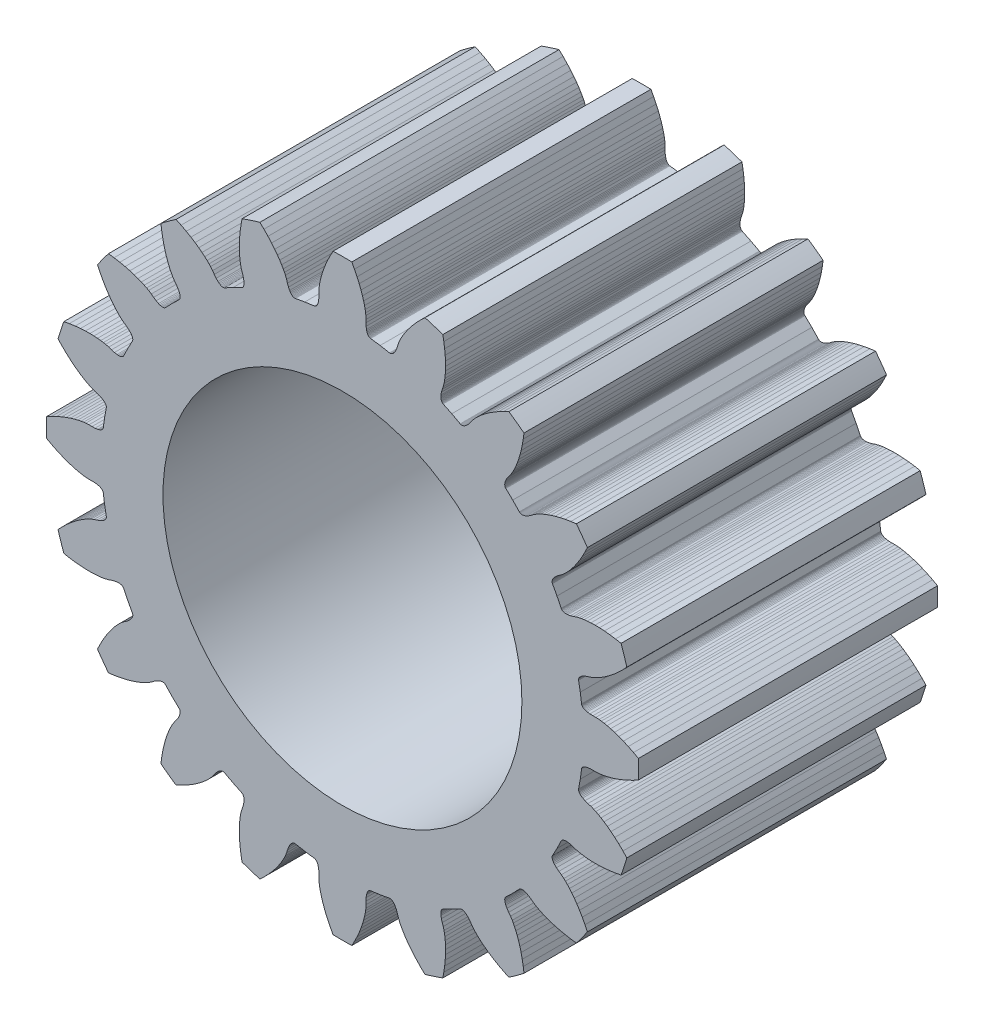
from build123d import *

# Parameters (mm, degrees)
MODEL_R             = 6
BOSS_EXTRUDE1_DEPTH = 10


with BuildPart() as part:
    # Model → Boss-Extrude1 (new body)
    with BuildSketch(Plane.XY):
        with BuildLine():
            Line((9.2379519, 2.4882789), (9.3780058, 2.624313))
            Line((9.3780058, 2.624313), (9.507329774, 2.760508399))
            ThreePointArc((9.507329774, 2.760508399), (9.415446022, 3.059263845), (9.314177481, 3.354969988))
            Line((9.314177481, 3.354969988), (9.1294985, 3.3891397))
            Line((9.1294985, 3.3891397), (8.9362338, 3.416872))
            Line((8.9362338, 3.416872), (8.7574297, 3.4349242))
            Line((8.7574297, 3.4349242), (8.5927812, 3.4446224))
            Line((8.5927812, 3.4446224), (8.4425429, 3.4471849))
            Line((8.4425429, 3.4471849), (8.3064777, 3.4437817))
            Line((8.3064777, 3.4437817), (8.1864137, 3.435737))
            Line((8.1864137, 3.435737), (8.0804821, 3.4241636))
            Line((8.0804821, 3.4241636), (7.9915462, 3.4106665))
            Line((7.9915462, 3.4106665), (7.917684, 3.3963088))
            Line((7.917684, 3.3963088), (7.8137095, 3.3696385))
            Line((7.8137095, 3.3696385), (7.71995, 3.3364447))
            Line((7.71995, 3.3364447), (7.6218333, 3.3081238))
            Line((7.6218333, 3.3081238), (7.5352909, 3.2933434))
            Line((7.5352909, 3.2933434), (7.4966615, 3.2907201))
            Line((7.4966615, 3.2907201), (7.4612697, 3.291082))
            Line((7.4612697, 3.291082), (7.4292239, 3.2943048))
            Line((7.4292239, 3.2943048), (7.4006412, 3.3002461))
            Line((7.4006412, 3.3002461), (7.375599, 3.3087546))
            Line((7.375599, 3.3087546), (7.3541968, 3.3196788))
            Line((7.3541968, 3.3196788), (7.3365339, 3.33289))
            Line((7.3365339, 3.33289), (7.3226832, 3.3482231))
            Line((7.3226832, 3.3482231), (7.3127264, 3.3655178))
            Line((7.3127264, 3.3655178), (7.1726025, 3.6546235))
            Line((7.1726025, 3.6546235), (7.0210738, 3.9379182))
            Line((7.0210738, 3.9379182), (7.0129346, 3.956139))
            Line((7.0129346, 3.956139), (7.0086711, 3.9763571))
            Line((7.0086711, 3.9763571), (7.008365, 3.998412))
            Line((7.008365, 3.998412), (7.012107, 4.0221478))
            Line((7.012107, 4.0221478), (7.019943, 4.0474085))
            Line((7.019943, 4.0474085), (7.0319368, 4.0740246))
            Line((7.0319368, 4.0740246), (7.0481656, 4.1018445))
            Line((7.0481656, 4.1018445), (7.0686756, 4.1306898))
            Line((7.0686756, 4.1306898), (7.0935037, 4.1603997))
            Line((7.0935037, 4.1603997), (7.1563296, 4.2217263))
            Line((7.1563296, 4.2217263), (7.2369132, 4.2844578))
            Line((7.2369132, 4.2844578), (7.318878, 4.3408))
            Line((7.318878, 4.3408), (7.4015694, 4.4092407))
            Line((7.4015694, 4.4092407), (7.4566001, 4.4605573))
            Line((7.4566001, 4.4605573), (7.5197947, 4.5245745))
            Line((7.5197947, 4.5245745), (7.5914229, 4.6034723))
            Line((7.5914229, 4.6034723), (7.668503, 4.6958775))
            Line((7.668503, 4.6958775), (7.7512334, 4.8039562))
            Line((7.7512334, 4.8039562), (7.8374682, 4.9270078))
            Line((7.8374682, 4.9270078), (7.9264001, 5.0659117))
            Line((7.9264001, 5.0659117), (8.0168939, 5.221178))
            Line((8.0168939, 5.221178), (8.1080562, 5.3938331))
            Line((8.1080562, 5.3938331), (8.188964013, 5.563326015))
            ThreePointArc((8.188964013, 5.563326015), (8.009256945, 5.819065738), (7.821566517, 6.069005209))
            Line((7.821566517, 6.069005209), (7.6353673, 6.0444336))
            Line((7.6353673, 6.0444336), (7.4429918, 6.0110865))
            Line((7.4429918, 6.0110865), (7.2673607, 5.9730017))
            Line((7.2673607, 5.9730017), (7.1077737, 5.931346))
            Line((7.1077737, 5.931346), (6.9640967, 5.8873569))
            Line((6.9640967, 5.8873569), (6.8357427, 5.8420738))
            Line((6.8357427, 5.8420738), (6.724041, 5.797321))
            Line((6.724041, 5.797321), (6.6268704, 5.7535794))
            Line((6.6268704, 5.7535794), (6.5464582, 5.7132602))
            Line((6.5464582, 5.7132602), (6.4806478, 5.6767805))
            Line((6.4806478, 5.6767805), (6.3900038, 5.6192857))
            Line((6.3900038, 5.6192857), (6.3110907, 5.5587432))
            Line((6.3110907, 5.5587432), (6.2265278, 5.5014887))
            Line((6.2265278, 5.5014887), (6.1487884, 5.4606887))
            Line((6.1487884, 5.4606887), (6.1128603, 5.4462566))
            Line((6.1128603, 5.4462566), (6.0790889, 5.4356642))
            Line((6.0790889, 5.4356642), (6.0476156, 5.4288265))
            Line((6.0476156, 5.4288265), (6.0185959, 5.4256445))
            Line((6.0185959, 5.4256445), (5.9921501, 5.425998))
            Line((5.9921501, 5.425998), (5.9684196, 5.429774))
            Line((5.9684196, 5.429774), (5.9475388, 5.4368804))
            Line((5.9475388, 5.4368804), (5.9296278, 5.4471829))
            Line((5.9296278, 5.4471829), (5.9148139, 5.4605543))
            Line((5.9148139, 5.4605543), (5.6922096, 5.6922096))
            Line((5.6922096, 5.6922096), (5.4605543, 5.9148139))
            Line((5.4605543, 5.9148139), (5.4471829, 5.9296278))
            Line((5.4471829, 5.9296278), (5.4368804, 5.9475388))
            Line((5.4368804, 5.9475388), (5.429774, 5.9684196))
            Line((5.429774, 5.9684196), (5.425998, 5.9921501))
            Line((5.425998, 5.9921501), (5.4256445, 6.0185959))
            Line((5.4256445, 6.0185959), (5.4288265, 6.0476156))
            Line((5.4288265, 6.0476156), (5.4356642, 6.0790889))
            Line((5.4356642, 6.0790889), (5.4462566, 6.1128603))
            Line((5.4462566, 6.1128603), (5.4606887, 6.1487884))
            Line((5.4606887, 6.1487884), (5.5014887, 6.2265278))
            Line((5.5014887, 6.2265278), (5.5587432, 6.3110907))
            Line((5.5587432, 6.3110907), (5.6192857, 6.3900038))
            Line((5.6192857, 6.3900038), (5.6767805, 6.4806478))
            Line((5.6767805, 6.4806478), (5.7132602, 6.5464582))
            Line((5.7132602, 6.5464582), (5.7535794, 6.6268704))
            Line((5.7535794, 6.6268704), (5.797321, 6.724041))
            Line((5.797321, 6.724041), (5.8420738, 6.8357427))
            Line((5.8420738, 6.8357427), (5.8873569, 6.9640967))
            Line((5.8873569, 6.9640967), (5.931346, 7.1077737))
            Line((5.931346, 7.1077737), (5.9730017, 7.2673607))
            Line((5.9730017, 7.2673607), (6.0110865, 7.4429918))
            Line((6.0110865, 7.4429918), (6.0444336, 7.6353673))
            Line((6.0444336, 7.6353673), (6.069005209, 7.821566417))
            ThreePointArc((6.069005209, 7.821566417), (5.819065783, 8.009256907), (5.563326015, 8.188963913))
            Line((5.563326015, 8.188963913), (5.3938331, 8.1080562))
            Line((5.3938331, 8.1080562), (5.221178, 8.0168939))
            Line((5.221178, 8.0168939), (5.0659117, 7.9264001))
            Line((5.0659117, 7.9264001), (4.9270078, 7.8374682))
            Line((4.9270078, 7.8374682), (4.8039562, 7.7512334))
            Line((4.8039562, 7.7512334), (4.6958775, 7.668503))
            Line((4.6958775, 7.668503), (4.6034723, 7.5914229))
            Line((4.6034723, 7.5914229), (4.5245745, 7.5197947))
            Line((4.5245745, 7.5197947), (4.4605573, 7.4566001))
            Line((4.4605573, 7.4566001), (4.4092407, 7.4015694))
            Line((4.4092407, 7.4015694), (4.3408, 7.318878))
            Line((4.3408, 7.318878), (4.2844578, 7.2369132))
            Line((4.2844578, 7.2369132), (4.2217263, 7.1563296))
            Line((4.2217263, 7.1563296), (4.1603997, 7.0935037))
            Line((4.1603997, 7.0935037), (4.1306898, 7.0686756))
            Line((4.1306898, 7.0686756), (4.1018445, 7.0481656))
            Line((4.1018445, 7.0481656), (4.0740246, 7.0319368))
            Line((4.0740246, 7.0319368), (4.0474085, 7.019943))
            Line((4.0474085, 7.019943), (4.0221478, 7.012107))
            Line((4.0221478, 7.012107), (3.998412, 7.008365))
            Line((3.998412, 7.008365), (3.9763571, 7.0086711))
            Line((3.9763571, 7.0086711), (3.956139, 7.0129346))
            Line((3.956139, 7.0129346), (3.9379182, 7.0210738))
            Line((3.9379182, 7.0210738), (3.6546235, 7.1726025))
            Line((3.6546235, 7.1726025), (3.3655178, 7.3127264))
            Line((3.3655178, 7.3127264), (3.3482231, 7.3226832))
            Line((3.3482231, 7.3226832), (3.33289, 7.3365339))
            Line((3.33289, 7.3365339), (3.3196788, 7.3541968))
            Line((3.3196788, 7.3541968), (3.3087546, 7.375599))
            Line((3.3087546, 7.375599), (3.3002461, 7.4006412))
            Line((3.3002461, 7.4006412), (3.2943048, 7.4292239))
            Line((3.2943048, 7.4292239), (3.291082, 7.4612697))
            Line((3.291082, 7.4612697), (3.2907201, 7.4966615))
            Line((3.2907201, 7.4966615), (3.2933434, 7.5352909))
            Line((3.2933434, 7.5352909), (3.3081238, 7.6218333))
            Line((3.3081238, 7.6218333), (3.3364447, 7.71995))
            Line((3.3364447, 7.71995), (3.3696385, 7.8137095))
            Line((3.3696385, 7.8137095), (3.3963088, 7.917684))
            Line((3.3963088, 7.917684), (3.4106665, 7.9915462))
            Line((3.4106665, 7.9915462), (3.4241636, 8.0804821))
            Line((3.4241636, 8.0804821), (3.435737, 8.1864137))
            Line((3.435737, 8.1864137), (3.4437817, 8.3064777))
            Line((3.4437817, 8.3064777), (3.4471849, 8.4425429))
            Line((3.4471849, 8.4425429), (3.4446224, 8.5927812))
            Line((3.4446224, 8.5927812), (3.4349242, 8.7574297))
            Line((3.4349242, 8.7574297), (3.416872, 8.9362338))
            Line((3.416872, 8.9362338), (3.3891397, 9.1294985))
            Line((3.3891397, 9.1294985), (3.354969988, 9.314177481))
            ThreePointArc((3.354969988, 9.314177481), (3.05926395, 9.415446345), (2.760508399, 9.507329774))
            Line((2.760508399, 9.507329774), (2.624313, 9.3780058))
            Line((2.624313, 9.3780058), (2.4882789, 9.2379519))
            Line((2.4882789, 9.2379519), (2.368576, 9.1039073))
            Line((2.368576, 9.1039073), (2.263952, 8.9764043))
            Line((2.263952, 8.9764043), (2.173571, 8.8563651))
            Line((2.173571, 8.8563651), (2.0963472, 8.7442857))
            Line((2.0963472, 8.7442857), (2.0322837, 8.6424234))
            Line((2.0322837, 8.6424234), (1.9793817, 8.5499202))
            Line((1.9793817, 8.5499202), (1.9380259, 8.4700362))
            Line((1.9380259, 8.4700362), (1.9062263, 8.4018411))
            Line((1.9062263, 8.4018411), (1.8666884, 8.3020476))
            Line((1.8666884, 8.3020476), (1.8384323, 8.2066837))
            Line((1.8384323, 8.2066837), (1.8036728, 8.1106591))
            Line((1.8036728, 8.1106591), (1.7647621, 8.0319571))
            Line((1.7647621, 8.0319571), (1.7441786, 7.9991633))
            Line((1.7441786, 7.9991633), (1.723083, 7.9707435))
            Line((1.723083, 7.9707435), (1.7016397, 7.9467121))
            Line((1.7016397, 7.9467121), (1.6800326, 7.9270805))
            Line((1.6800326, 7.9270805), (1.6584297, 7.9118221))
            Line((1.6584297, 7.9118221), (1.6370119, 7.9009285))
            Line((1.6370119, 7.9009285), (1.6159418, 7.8944042))
            Line((1.6159418, 7.8944042), (1.5953958, 7.8922113))
            Line((1.5953958, 7.8922113), (1.5755516, 7.8943216))
            Line((1.5755516, 7.8943216), (1.2592974, 7.9508911))
            Line((1.2592974, 7.9508911), (0.9410409, 7.9948183))
            Line((0.9410409, 7.9948183), (0.9215158, 7.9989434))
            Line((0.9215158, 7.9989434), (0.9026531, 8.0073781))
            Line((0.9026531, 8.0073781), (0.8846304, 8.020094))
            Line((0.8846304, 8.020094), (0.8676271, 8.0370729))
            Line((0.8676271, 8.0370729), (0.8517967, 8.0582602))
            Line((0.8517967, 8.0582602), (0.8373136, 8.0836079))
            Line((0.8373136, 8.0836079), (0.8243459, 8.1130895))
            Line((0.8243459, 8.1130895), (0.813065, 8.1466372))
            Line((0.813065, 8.1466372), (0.8036228, 8.1841866))
            Line((0.8036228, 8.1841866), (0.7909367, 8.2710607))
            Line((0.7909367, 8.2710607), (0.7875517, 8.3731269))
            Line((0.7875517, 8.3731269), (0.7901476, 8.4725549))
            Line((0.7901476, 8.4725549), (0.7833827, 8.5796821))
            Line((0.7833827, 8.5796821), (0.774213, 8.654366))
            Line((0.774213, 8.654366), (0.7595668, 8.7431199))
            Line((0.7595668, 8.7431199), (0.7378391, 8.8474432))
            Line((0.7378391, 8.8474432), (0.7083883, 8.9641168))
            Line((0.7083883, 8.9641168), (0.6695785, 9.0945742))
            Line((0.6695785, 9.0945742), (0.6207152, 9.2366675))
            Line((0.6207152, 9.2366675), (0.5606125, 9.3902606))
            Line((0.5606125, 9.3902606), (0.4881903, 9.5547349))
            Line((0.4881903, 9.5547349), (0.4020932, 9.7299708))
            Line((0.4020932, 9.7299708), (0.312526994, 9.895051988))
            ThreePointArc((0.312526994, 9.895051988), (4.8e-08, 9.89998593), (-0.312526897, 9.895051984))
            Line((-0.312526897, 9.895051984), (-0.4020932, 9.7299708))
            Line((-0.4020932, 9.7299708), (-0.4881903, 9.5547349))
            Line((-0.4881903, 9.5547349), (-0.5606125, 9.3902606))
            Line((-0.5606125, 9.3902606), (-0.6207152, 9.2366675))
            Line((-0.6207152, 9.2366675), (-0.6695785, 9.0945742))
            Line((-0.6695785, 9.0945742), (-0.7083883, 8.9641168))
            Line((-0.7083883, 8.9641168), (-0.7378391, 8.8474432))
            Line((-0.7378391, 8.8474432), (-0.7595668, 8.7431199))
            Line((-0.7595668, 8.7431199), (-0.774213, 8.654366))
            Line((-0.774213, 8.654366), (-0.7833827, 8.5796821))
            Line((-0.7833827, 8.5796821), (-0.7901476, 8.4725549))
            Line((-0.7901476, 8.4725549), (-0.7875517, 8.3731269))
            Line((-0.7875517, 8.3731269), (-0.7909367, 8.2710607))
            Line((-0.7909367, 8.2710607), (-0.8036228, 8.1841866))
            Line((-0.8036228, 8.1841866), (-0.813065, 8.1466372))
            Line((-0.813065, 8.1466372), (-0.8243459, 8.1130895))
            Line((-0.8243459, 8.1130895), (-0.8373136, 8.0836079))
            Line((-0.8373136, 8.0836079), (-0.8517967, 8.0582602))
            Line((-0.8517967, 8.0582602), (-0.8676271, 8.0370729))
            Line((-0.8676271, 8.0370729), (-0.8846304, 8.020094))
            Line((-0.8846304, 8.020094), (-0.9026531, 8.0073781))
            Line((-0.9026531, 8.0073781), (-0.9215158, 7.9989434))
            Line((-0.9215158, 7.9989434), (-0.9410409, 7.9948183))
            Line((-0.9410409, 7.9948183), (-1.2592974, 7.9508911))
            Line((-1.2592974, 7.9508911), (-1.5755516, 7.8943216))
            Line((-1.5755516, 7.8943216), (-1.5953958, 7.8922113))
            Line((-1.5953958, 7.8922113), (-1.6159418, 7.8944042))
            Line((-1.6159418, 7.8944042), (-1.6370119, 7.9009285))
            Line((-1.6370119, 7.9009285), (-1.6584297, 7.9118221))
            Line((-1.6584297, 7.9118221), (-1.6800326, 7.9270805))
            Line((-1.6800326, 7.9270805), (-1.7016397, 7.9467121))
            Line((-1.7016397, 7.9467121), (-1.723083, 7.9707435))
            Line((-1.723083, 7.9707435), (-1.7441786, 7.9991633))
            Line((-1.7441786, 7.9991633), (-1.7647621, 8.0319571))
            Line((-1.7647621, 8.0319571), (-1.8036728, 8.1106591))
            Line((-1.8036728, 8.1106591), (-1.8384323, 8.2066837))
            Line((-1.8384323, 8.2066837), (-1.8666884, 8.3020476))
            Line((-1.8666884, 8.3020476), (-1.9062263, 8.4018411))
            Line((-1.9062263, 8.4018411), (-1.9380259, 8.4700362))
            Line((-1.9380259, 8.4700362), (-1.9793817, 8.5499202))
            Line((-1.9793817, 8.5499202), (-2.0322837, 8.6424234))
            Line((-2.0322837, 8.6424234), (-2.0963472, 8.7442857))
            Line((-2.0963472, 8.7442857), (-2.173571, 8.8563651))
            Line((-2.173571, 8.8563651), (-2.263952, 8.9764043))
            Line((-2.263952, 8.9764043), (-2.368576, 9.1039073))
            Line((-2.368576, 9.1039073), (-2.4882789, 9.2379519))
            Line((-2.4882789, 9.2379519), (-2.624313, 9.3780058))
            Line((-2.624313, 9.3780058), (-2.760508399, 9.507329774))
            ThreePointArc((-2.760508399, 9.507329774), (-3.059263904, 9.415446203), (-3.354969988, 9.314177481))
            Line((-3.354969988, 9.314177481), (-3.3891397, 9.1294985))
            Line((-3.3891397, 9.1294985), (-3.416872, 8.9362338))
            Line((-3.416872, 8.9362338), (-3.4349242, 8.7574297))
            Line((-3.4349242, 8.7574297), (-3.4446224, 8.5927812))
            Line((-3.4446224, 8.5927812), (-3.4471849, 8.4425429))
            Line((-3.4471849, 8.4425429), (-3.4437817, 8.3064777))
            Line((-3.4437817, 8.3064777), (-3.435737, 8.1864137))
            Line((-3.435737, 8.1864137), (-3.4241636, 8.0804821))
            Line((-3.4241636, 8.0804821), (-3.4106665, 7.9915462))
            Line((-3.4106665, 7.9915462), (-3.3963088, 7.917684))
            Line((-3.3963088, 7.917684), (-3.3696385, 7.8137095))
            Line((-3.3696385, 7.8137095), (-3.3364447, 7.71995))
            Line((-3.3364447, 7.71995), (-3.3081238, 7.6218333))
            Line((-3.3081238, 7.6218333), (-3.2933434, 7.5352909))
            Line((-3.2933434, 7.5352909), (-3.2907201, 7.4966615))
            Line((-3.2907201, 7.4966615), (-3.291082, 7.4612697))
            Line((-3.291082, 7.4612697), (-3.2943048, 7.4292239))
            Line((-3.2943048, 7.4292239), (-3.3002461, 7.4006412))
            Line((-3.3002461, 7.4006412), (-3.3087546, 7.375599))
            Line((-3.3087546, 7.375599), (-3.3196788, 7.3541968))
            Line((-3.3196788, 7.3541968), (-3.33289, 7.3365339))
            Line((-3.33289, 7.3365339), (-3.3482231, 7.3226832))
            Line((-3.3482231, 7.3226832), (-3.3655178, 7.3127264))
            Line((-3.3655178, 7.3127264), (-3.6546235, 7.1726025))
            Line((-3.6546235, 7.1726025), (-3.9379182, 7.0210738))
            Line((-3.9379182, 7.0210738), (-3.956139, 7.0129346))
            Line((-3.956139, 7.0129346), (-3.9763571, 7.0086711))
            Line((-3.9763571, 7.0086711), (-3.998412, 7.008365))
            Line((-3.998412, 7.008365), (-4.0221478, 7.012107))
            Line((-4.0221478, 7.012107), (-4.0474085, 7.019943))
            Line((-4.0474085, 7.019943), (-4.0740246, 7.0319368))
            Line((-4.0740246, 7.0319368), (-4.1018445, 7.0481656))
            Line((-4.1018445, 7.0481656), (-4.1306898, 7.0686756))
            Line((-4.1306898, 7.0686756), (-4.1603997, 7.0935037))
            Line((-4.1603997, 7.0935037), (-4.2217263, 7.1563296))
            Line((-4.2217263, 7.1563296), (-4.2844578, 7.2369132))
            Line((-4.2844578, 7.2369132), (-4.3408, 7.318878))
            Line((-4.3408, 7.318878), (-4.4092407, 7.4015694))
            Line((-4.4092407, 7.4015694), (-4.4605573, 7.4566001))
            Line((-4.4605573, 7.4566001), (-4.5245745, 7.5197947))
            Line((-4.5245745, 7.5197947), (-4.6034723, 7.5914229))
            Line((-4.6034723, 7.5914229), (-4.6958775, 7.668503))
            Line((-4.6958775, 7.668503), (-4.8039562, 7.7512334))
            Line((-4.8039562, 7.7512334), (-4.9270078, 7.8374682))
            Line((-4.9270078, 7.8374682), (-5.0659117, 7.9264001))
            Line((-5.0659117, 7.9264001), (-5.221178, 8.0168939))
            Line((-5.221178, 8.0168939), (-5.3938331, 8.1080562))
            Line((-5.3938331, 8.1080562), (-5.563326015, 8.188964013))
            ThreePointArc((-5.563326015, 8.188964013), (-5.819065871, 8.009257128), (-6.069005209, 7.821566517))
            Line((-6.069005209, 7.821566517), (-6.0444336, 7.6353673))
            Line((-6.0444336, 7.6353673), (-6.0110865, 7.4429918))
            Line((-6.0110865, 7.4429918), (-5.9730017, 7.2673607))
            Line((-5.9730017, 7.2673607), (-5.931346, 7.1077737))
            Line((-5.931346, 7.1077737), (-5.8873569, 6.9640967))
            Line((-5.8873569, 6.9640967), (-5.8420738, 6.8357427))
            Line((-5.8420738, 6.8357427), (-5.797321, 6.724041))
            Line((-5.797321, 6.724041), (-5.7535794, 6.6268704))
            Line((-5.7535794, 6.6268704), (-5.7132602, 6.5464582))
            Line((-5.7132602, 6.5464582), (-5.6767805, 6.4806478))
            Line((-5.6767805, 6.4806478), (-5.6192857, 6.3900038))
            Line((-5.6192857, 6.3900038), (-5.5587432, 6.3110907))
            Line((-5.5587432, 6.3110907), (-5.5014887, 6.2265278))
            Line((-5.5014887, 6.2265278), (-5.4606887, 6.1487884))
            Line((-5.4606887, 6.1487884), (-5.4462566, 6.1128603))
            Line((-5.4462566, 6.1128603), (-5.4356642, 6.0790889))
            Line((-5.4356642, 6.0790889), (-5.4288265, 6.0476156))
            Line((-5.4288265, 6.0476156), (-5.4256445, 6.0185959))
            Line((-5.4256445, 6.0185959), (-5.425998, 5.9921501))
            Line((-5.425998, 5.9921501), (-5.429774, 5.9684196))
            Line((-5.429774, 5.9684196), (-5.4368804, 5.9475388))
            Line((-5.4368804, 5.9475388), (-5.4471829, 5.9296278))
            Line((-5.4471829, 5.9296278), (-5.4605543, 5.9148139))
            Line((-5.4605543, 5.9148139), (-5.6922096, 5.6922096))
            Line((-5.6922096, 5.6922096), (-5.9148139, 5.4605543))
            Line((-5.9148139, 5.4605543), (-5.9296278, 5.4471829))
            Line((-5.9296278, 5.4471829), (-5.9475388, 5.4368804))
            Line((-5.9475388, 5.4368804), (-5.9684196, 5.429774))
            Line((-5.9684196, 5.429774), (-5.9921501, 5.425998))
            Line((-5.9921501, 5.425998), (-6.0185959, 5.4256445))
            Line((-6.0185959, 5.4256445), (-6.0476156, 5.4288265))
            Line((-6.0476156, 5.4288265), (-6.0790889, 5.4356642))
            Line((-6.0790889, 5.4356642), (-6.1128603, 5.4462566))
            Line((-6.1128603, 5.4462566), (-6.1487884, 5.4606887))
            Line((-6.1487884, 5.4606887), (-6.2265278, 5.5014887))
            Line((-6.2265278, 5.5014887), (-6.3110907, 5.5587432))
            Line((-6.3110907, 5.5587432), (-6.3900038, 5.6192857))
            Line((-6.3900038, 5.6192857), (-6.4806478, 5.6767805))
            Line((-6.4806478, 5.6767805), (-6.5464582, 5.7132602))
            Line((-6.5464582, 5.7132602), (-6.6268704, 5.7535794))
            Line((-6.6268704, 5.7535794), (-6.724041, 5.797321))
            Line((-6.724041, 5.797321), (-6.8357427, 5.8420738))
            Line((-6.8357427, 5.8420738), (-6.9640967, 5.8873569))
            Line((-6.9640967, 5.8873569), (-7.1077737, 5.931346))
            Line((-7.1077737, 5.931346), (-7.2673607, 5.9730017))
            Line((-7.2673607, 5.9730017), (-7.4429918, 6.0110865))
            Line((-7.4429918, 6.0110865), (-7.6353673, 6.0444336))
            Line((-7.6353673, 6.0444336), (-7.821566417, 6.069005209))
            ThreePointArc((-7.821566417, 6.069005209), (-8.009256802, 5.819065707), (-8.188963913, 5.563326015))
            Line((-8.188963913, 5.563326015), (-8.1080562, 5.3938331))
            Line((-8.1080562, 5.3938331), (-8.0168939, 5.221178))
            Line((-8.0168939, 5.221178), (-7.9264001, 5.0659117))
            Line((-7.9264001, 5.0659117), (-7.8374682, 4.9270078))
            Line((-7.8374682, 4.9270078), (-7.7512334, 4.8039562))
            Line((-7.7512334, 4.8039562), (-7.668503, 4.6958775))
            Line((-7.668503, 4.6958775), (-7.5914229, 4.6034723))
            Line((-7.5914229, 4.6034723), (-7.5197947, 4.5245745))
            Line((-7.5197947, 4.5245745), (-7.4566001, 4.4605573))
            Line((-7.4566001, 4.4605573), (-7.4015694, 4.4092407))
            Line((-7.4015694, 4.4092407), (-7.318878, 4.3408))
            Line((-7.318878, 4.3408), (-7.2369132, 4.2844578))
            Line((-7.2369132, 4.2844578), (-7.1563296, 4.2217263))
            Line((-7.1563296, 4.2217263), (-7.0935037, 4.1603997))
            Line((-7.0935037, 4.1603997), (-7.0686756, 4.1306898))
            Line((-7.0686756, 4.1306898), (-7.0481656, 4.1018445))
            Line((-7.0481656, 4.1018445), (-7.0319368, 4.0740246))
            Line((-7.0319368, 4.0740246), (-7.019943, 4.0474085))
            Line((-7.019943, 4.0474085), (-7.012107, 4.0221478))
            Line((-7.012107, 4.0221478), (-7.008365, 3.998412))
            Line((-7.008365, 3.998412), (-7.0086711, 3.9763571))
            Line((-7.0086711, 3.9763571), (-7.0129346, 3.956139))
            Line((-7.0129346, 3.956139), (-7.0210738, 3.9379182))
            Line((-7.0210738, 3.9379182), (-7.1726025, 3.6546235))
            Line((-7.1726025, 3.6546235), (-7.3127264, 3.3655178))
            Line((-7.3127264, 3.3655178), (-7.3226832, 3.3482231))
            Line((-7.3226832, 3.3482231), (-7.3365339, 3.33289))
            Line((-7.3365339, 3.33289), (-7.3541968, 3.3196788))
            Line((-7.3541968, 3.3196788), (-7.375599, 3.3087546))
            Line((-7.375599, 3.3087546), (-7.4006412, 3.3002461))
            Line((-7.4006412, 3.3002461), (-7.4292239, 3.2943048))
            Line((-7.4292239, 3.2943048), (-7.4612697, 3.291082))
            Line((-7.4612697, 3.291082), (-7.4966615, 3.2907201))
            Line((-7.4966615, 3.2907201), (-7.5352909, 3.2933434))
            Line((-7.5352909, 3.2933434), (-7.6218333, 3.3081238))
            Line((-7.6218333, 3.3081238), (-7.71995, 3.3364447))
            Line((-7.71995, 3.3364447), (-7.8137095, 3.3696385))
            Line((-7.8137095, 3.3696385), (-7.917684, 3.3963088))
            Line((-7.917684, 3.3963088), (-7.9915462, 3.4106665))
            Line((-7.9915462, 3.4106665), (-8.0804821, 3.4241636))
            Line((-8.0804821, 3.4241636), (-8.1864137, 3.435737))
            Line((-8.1864137, 3.435737), (-8.3064777, 3.4437817))
            Line((-8.3064777, 3.4437817), (-8.4425429, 3.4471849))
            Line((-8.4425429, 3.4471849), (-8.5927812, 3.4446224))
            Line((-8.5927812, 3.4446224), (-8.7574297, 3.4349242))
            Line((-8.7574297, 3.4349242), (-8.9362338, 3.416872))
            Line((-8.9362338, 3.416872), (-9.1294985, 3.3891397))
            Line((-9.1294985, 3.3891397), (-9.314177481, 3.354969988))
            ThreePointArc((-9.314177481, 3.354969988), (-9.415446207, 3.059263905), (-9.507329774, 2.760508399))
            Line((-9.507329774, 2.760508399), (-9.3780058, 2.624313))
            Line((-9.3780058, 2.624313), (-9.2379519, 2.4882789))
            Line((-9.2379519, 2.4882789), (-9.1039073, 2.368576))
            Line((-9.1039073, 2.368576), (-8.9764043, 2.263952))
            Line((-8.9764043, 2.263952), (-8.8563651, 2.173571))
            Line((-8.8563651, 2.173571), (-8.7442857, 2.0963472))
            Line((-8.7442857, 2.0963472), (-8.6424234, 2.0322837))
            Line((-8.6424234, 2.0322837), (-8.5499202, 1.9793817))
            Line((-8.5499202, 1.9793817), (-8.4700362, 1.9380259))
            Line((-8.4700362, 1.9380259), (-8.4018411, 1.9062263))
            Line((-8.4018411, 1.9062263), (-8.3020476, 1.8666884))
            Line((-8.3020476, 1.8666884), (-8.2066837, 1.8384323))
            Line((-8.2066837, 1.8384323), (-8.1106591, 1.8036728))
            Line((-8.1106591, 1.8036728), (-8.0319571, 1.7647621))
            Line((-8.0319571, 1.7647621), (-7.9991633, 1.7441786))
            Line((-7.9991633, 1.7441786), (-7.9707435, 1.723083))
            Line((-7.9707435, 1.723083), (-7.9467121, 1.7016397))
            Line((-7.9467121, 1.7016397), (-7.9270805, 1.6800326))
            Line((-7.9270805, 1.6800326), (-7.9118221, 1.6584297))
            Line((-7.9118221, 1.6584297), (-7.9009285, 1.6370119))
            Line((-7.9009285, 1.6370119), (-7.8944042, 1.6159418))
            Line((-7.8944042, 1.6159418), (-7.8922113, 1.5953958))
            Line((-7.8922113, 1.5953958), (-7.8943216, 1.5755516))
            Line((-7.8943216, 1.5755516), (-7.9508911, 1.2592974))
            Line((-7.9508911, 1.2592974), (-7.9948183, 0.9410409))
            Line((-7.9948183, 0.9410409), (-7.9989434, 0.9215158))
            Line((-7.9989434, 0.9215158), (-8.0073781, 0.9026531))
            Line((-8.0073781, 0.9026531), (-8.020094, 0.8846304))
            Line((-8.020094, 0.8846304), (-8.0370729, 0.8676271))
            Line((-8.0370729, 0.8676271), (-8.0582602, 0.8517967))
            Line((-8.0582602, 0.8517967), (-8.0836079, 0.8373136))
            Line((-8.0836079, 0.8373136), (-8.1130895, 0.8243459))
            Line((-8.1130895, 0.8243459), (-8.1466372, 0.813065))
            Line((-8.1466372, 0.813065), (-8.1841866, 0.8036228))
            Line((-8.1841866, 0.8036228), (-8.2710607, 0.7909367))
            Line((-8.2710607, 0.7909367), (-8.3731269, 0.7875517))
            Line((-8.3731269, 0.7875517), (-8.4725549, 0.7901476))
            Line((-8.4725549, 0.7901476), (-8.5796821, 0.7833827))
            Line((-8.5796821, 0.7833827), (-8.654366, 0.774213))
            Line((-8.654366, 0.774213), (-8.7431199, 0.7595668))
            Line((-8.7431199, 0.7595668), (-8.8474432, 0.7378391))
            Line((-8.8474432, 0.7378391), (-8.9641168, 0.7083883))
            Line((-8.9641168, 0.7083883), (-9.0945742, 0.6695785))
            Line((-9.0945742, 0.6695785), (-9.2366675, 0.6207152))
            Line((-9.2366675, 0.6207152), (-9.3902606, 0.5606125))
            Line((-9.3902606, 0.5606125), (-9.5547349, 0.4881903))
            Line((-9.5547349, 0.4881903), (-9.7299708, 0.4020932))
            Line((-9.7299708, 0.4020932), (-9.895051988, 0.312526994))
            ThreePointArc((-9.895051988, 0.312526994), (-9.8999862, 4.8e-08), (-9.895051984, -0.312526897))
            Line((-9.895051984, -0.312526897), (-9.7299708, -0.4020932))
            Line((-9.7299708, -0.4020932), (-9.5547349, -0.4881903))
            Line((-9.5547349, -0.4881903), (-9.3902606, -0.5606125))
            Line((-9.3902606, -0.5606125), (-9.2366675, -0.6207152))
            Line((-9.2366675, -0.6207152), (-9.0945742, -0.6695785))
            Line((-9.0945742, -0.6695785), (-8.9641168, -0.7083883))
            Line((-8.9641168, -0.7083883), (-8.8474432, -0.7378391))
            Line((-8.8474432, -0.7378391), (-8.7431199, -0.7595668))
            Line((-8.7431199, -0.7595668), (-8.654366, -0.774213))
            Line((-8.654366, -0.774213), (-8.5796821, -0.7833827))
            Line((-8.5796821, -0.7833827), (-8.4725549, -0.7901476))
            Line((-8.4725549, -0.7901476), (-8.3731269, -0.7875517))
            Line((-8.3731269, -0.7875517), (-8.2710607, -0.7909367))
            Line((-8.2710607, -0.7909367), (-8.1841866, -0.8036228))
            Line((-8.1841866, -0.8036228), (-8.1466372, -0.813065))
            Line((-8.1466372, -0.813065), (-8.1130895, -0.8243459))
            Line((-8.1130895, -0.8243459), (-8.0836079, -0.8373136))
            Line((-8.0836079, -0.8373136), (-8.0582602, -0.8517967))
            Line((-8.0582602, -0.8517967), (-8.0370729, -0.8676271))
            Line((-8.0370729, -0.8676271), (-8.020094, -0.8846304))
            Line((-8.020094, -0.8846304), (-8.0073781, -0.9026531))
            Line((-8.0073781, -0.9026531), (-7.9989434, -0.9215158))
            Line((-7.9989434, -0.9215158), (-7.9948183, -0.9410409))
            Line((-7.9948183, -0.9410409), (-7.9508911, -1.2592974))
            Line((-7.9508911, -1.2592974), (-7.8943216, -1.5755516))
            Line((-7.8943216, -1.5755516), (-7.8922113, -1.5953958))
            Line((-7.8922113, -1.5953958), (-7.8944042, -1.6159418))
            Line((-7.8944042, -1.6159418), (-7.9009285, -1.6370119))
            Line((-7.9009285, -1.6370119), (-7.9118221, -1.6584297))
            Line((-7.9118221, -1.6584297), (-7.9270805, -1.6800326))
            Line((-7.9270805, -1.6800326), (-7.9467121, -1.7016397))
            Line((-7.9467121, -1.7016397), (-7.9707435, -1.723083))
            Line((-7.9707435, -1.723083), (-7.9991633, -1.7441786))
            Line((-7.9991633, -1.7441786), (-8.0319571, -1.7647621))
            Line((-8.0319571, -1.7647621), (-8.1106591, -1.8036728))
            Line((-8.1106591, -1.8036728), (-8.2066837, -1.8384323))
            Line((-8.2066837, -1.8384323), (-8.3020476, -1.8666884))
            Line((-8.3020476, -1.8666884), (-8.4018411, -1.9062263))
            Line((-8.4018411, -1.9062263), (-8.4700362, -1.9380259))
            Line((-8.4700362, -1.9380259), (-8.5499202, -1.9793817))
            Line((-8.5499202, -1.9793817), (-8.6424234, -2.0322837))
            Line((-8.6424234, -2.0322837), (-8.7442857, -2.0963472))
            Line((-8.7442857, -2.0963472), (-8.8563651, -2.173571))
            Line((-8.8563651, -2.173571), (-8.9764043, -2.263952))
            Line((-8.9764043, -2.263952), (-9.1039073, -2.368576))
            Line((-9.1039073, -2.368576), (-9.2379519, -2.4882789))
            Line((-9.2379519, -2.4882789), (-9.3780058, -2.624313))
            Line((-9.3780058, -2.624313), (-9.507329774, -2.760508399))
            ThreePointArc((-9.507329774, -2.760508399), (-9.415446022, -3.059263845), (-9.314177481, -3.354969988))
            Line((-9.314177481, -3.354969988), (-9.1294985, -3.3891397))
            Line((-9.1294985, -3.3891397), (-8.9362338, -3.416872))
            Line((-8.9362338, -3.416872), (-8.7574297, -3.4349242))
            Line((-8.7574297, -3.4349242), (-8.5927812, -3.4446224))
            Line((-8.5927812, -3.4446224), (-8.4425429, -3.4471849))
            Line((-8.4425429, -3.4471849), (-8.3064777, -3.4437817))
            Line((-8.3064777, -3.4437817), (-8.1864137, -3.435737))
            Line((-8.1864137, -3.435737), (-8.0804821, -3.4241636))
            Line((-8.0804821, -3.4241636), (-7.9915462, -3.4106665))
            Line((-7.9915462, -3.4106665), (-7.917684, -3.3963088))
            Line((-7.917684, -3.3963088), (-7.8137095, -3.3696385))
            Line((-7.8137095, -3.3696385), (-7.71995, -3.3364447))
            Line((-7.71995, -3.3364447), (-7.6218333, -3.3081238))
            Line((-7.6218333, -3.3081238), (-7.5352909, -3.2933434))
            Line((-7.5352909, -3.2933434), (-7.4966615, -3.2907201))
            Line((-7.4966615, -3.2907201), (-7.4612697, -3.291082))
            Line((-7.4612697, -3.291082), (-7.4292239, -3.2943048))
            Line((-7.4292239, -3.2943048), (-7.4006412, -3.3002461))
            Line((-7.4006412, -3.3002461), (-7.375599, -3.3087546))
            Line((-7.375599, -3.3087546), (-7.3541968, -3.3196788))
            Line((-7.3541968, -3.3196788), (-7.3365339, -3.33289))
            Line((-7.3365339, -3.33289), (-7.3226832, -3.3482231))
            Line((-7.3226832, -3.3482231), (-7.3127264, -3.3655178))
            Line((-7.3127264, -3.3655178), (-7.1726025, -3.6546235))
            Line((-7.1726025, -3.6546235), (-7.0210738, -3.9379182))
            Line((-7.0210738, -3.9379182), (-7.0129346, -3.956139))
            Line((-7.0129346, -3.956139), (-7.0086711, -3.9763571))
            Line((-7.0086711, -3.9763571), (-7.008365, -3.998412))
            Line((-7.008365, -3.998412), (-7.012107, -4.0221478))
            Line((-7.012107, -4.0221478), (-7.019943, -4.0474085))
            Line((-7.019943, -4.0474085), (-7.0319368, -4.0740246))
            Line((-7.0319368, -4.0740246), (-7.0481656, -4.1018445))
            Line((-7.0481656, -4.1018445), (-7.0686756, -4.1306898))
            Line((-7.0686756, -4.1306898), (-7.0935037, -4.1603997))
            Line((-7.0935037, -4.1603997), (-7.1563296, -4.2217263))
            Line((-7.1563296, -4.2217263), (-7.2369132, -4.2844578))
            Line((-7.2369132, -4.2844578), (-7.318878, -4.3408))
            Line((-7.318878, -4.3408), (-7.4015694, -4.4092407))
            Line((-7.4015694, -4.4092407), (-7.4566001, -4.4605573))
            Line((-7.4566001, -4.4605573), (-7.5197947, -4.5245745))
            Line((-7.5197947, -4.5245745), (-7.5914229, -4.6034723))
            Line((-7.5914229, -4.6034723), (-7.668503, -4.6958775))
            Line((-7.668503, -4.6958775), (-7.7512334, -4.8039562))
            Line((-7.7512334, -4.8039562), (-7.8374682, -4.9270078))
            Line((-7.8374682, -4.9270078), (-7.9264001, -5.0659117))
            Line((-7.9264001, -5.0659117), (-8.0168939, -5.221178))
            Line((-8.0168939, -5.221178), (-8.1080562, -5.3938331))
            Line((-8.1080562, -5.3938331), (-8.188964013, -5.563326015))
            ThreePointArc((-8.188964013, -5.563326015), (-8.009256945, -5.819065738), (-7.821566517, -6.069005209))
            Line((-7.821566517, -6.069005209), (-7.6353673, -6.0444336))
            Line((-7.6353673, -6.0444336), (-7.4429918, -6.0110865))
            Line((-7.4429918, -6.0110865), (-7.2673607, -5.9730017))
            Line((-7.2673607, -5.9730017), (-7.1077737, -5.931346))
            Line((-7.1077737, -5.931346), (-6.9640967, -5.8873569))
            Line((-6.9640967, -5.8873569), (-6.8357427, -5.8420738))
            Line((-6.8357427, -5.8420738), (-6.724041, -5.797321))
            Line((-6.724041, -5.797321), (-6.6268704, -5.7535794))
            Line((-6.6268704, -5.7535794), (-6.5464582, -5.7132602))
            Line((-6.5464582, -5.7132602), (-6.4806478, -5.6767805))
            Line((-6.4806478, -5.6767805), (-6.3900038, -5.6192857))
            Line((-6.3900038, -5.6192857), (-6.3110907, -5.5587432))
            Line((-6.3110907, -5.5587432), (-6.2265278, -5.5014887))
            Line((-6.2265278, -5.5014887), (-6.1487884, -5.4606887))
            Line((-6.1487884, -5.4606887), (-6.1128603, -5.4462566))
            Line((-6.1128603, -5.4462566), (-6.0790889, -5.4356642))
            Line((-6.0790889, -5.4356642), (-6.0476156, -5.4288265))
            Line((-6.0476156, -5.4288265), (-6.0185959, -5.4256445))
            Line((-6.0185959, -5.4256445), (-5.9921501, -5.425998))
            Line((-5.9921501, -5.425998), (-5.9684196, -5.429774))
            Line((-5.9684196, -5.429774), (-5.9475388, -5.4368804))
            Line((-5.9475388, -5.4368804), (-5.9296278, -5.4471829))
            Line((-5.9296278, -5.4471829), (-5.9148139, -5.4605543))
            Line((-5.9148139, -5.4605543), (-5.6922096, -5.6922096))
            Line((-5.6922096, -5.6922096), (-5.4605543, -5.9148139))
            Line((-5.4605543, -5.9148139), (-5.4471829, -5.9296278))
            Line((-5.4471829, -5.9296278), (-5.4368804, -5.9475388))
            Line((-5.4368804, -5.9475388), (-5.429774, -5.9684196))
            Line((-5.429774, -5.9684196), (-5.425998, -5.9921501))
            Line((-5.425998, -5.9921501), (-5.4256445, -6.0185959))
            Line((-5.4256445, -6.0185959), (-5.4288265, -6.0476156))
            Line((-5.4288265, -6.0476156), (-5.4356642, -6.0790889))
            Line((-5.4356642, -6.0790889), (-5.4462566, -6.1128603))
            Line((-5.4462566, -6.1128603), (-5.4606887, -6.1487884))
            Line((-5.4606887, -6.1487884), (-5.5014887, -6.2265278))
            Line((-5.5014887, -6.2265278), (-5.5587432, -6.3110907))
            Line((-5.5587432, -6.3110907), (-5.6192857, -6.3900038))
            Line((-5.6192857, -6.3900038), (-5.6767805, -6.4806478))
            Line((-5.6767805, -6.4806478), (-5.7132602, -6.5464582))
            Line((-5.7132602, -6.5464582), (-5.7535794, -6.6268704))
            Line((-5.7535794, -6.6268704), (-5.797321, -6.724041))
            Line((-5.797321, -6.724041), (-5.8420738, -6.8357427))
            Line((-5.8420738, -6.8357427), (-5.8873569, -6.9640967))
            Line((-5.8873569, -6.9640967), (-5.931346, -7.1077737))
            Line((-5.931346, -7.1077737), (-5.9730017, -7.2673607))
            Line((-5.9730017, -7.2673607), (-6.0110865, -7.4429918))
            Line((-6.0110865, -7.4429918), (-6.0444336, -7.6353673))
            Line((-6.0444336, -7.6353673), (-6.069005209, -7.821566417))
            ThreePointArc((-6.069005209, -7.821566417), (-5.819065783, -8.009256907), (-5.563326015, -8.188963913))
            Line((-5.563326015, -8.188963913), (-5.3938331, -8.1080562))
            Line((-5.3938331, -8.1080562), (-5.221178, -8.0168939))
            Line((-5.221178, -8.0168939), (-5.0659117, -7.9264001))
            Line((-5.0659117, -7.9264001), (-4.9270078, -7.8374682))
            Line((-4.9270078, -7.8374682), (-4.8039562, -7.7512334))
            Line((-4.8039562, -7.7512334), (-4.6958775, -7.668503))
            Line((-4.6958775, -7.668503), (-4.6034723, -7.5914229))
            Line((-4.6034723, -7.5914229), (-4.5245745, -7.5197947))
            Line((-4.5245745, -7.5197947), (-4.4605573, -7.4566001))
            Line((-4.4605573, -7.4566001), (-4.4092407, -7.4015694))
            Line((-4.4092407, -7.4015694), (-4.3408, -7.318878))
            Line((-4.3408, -7.318878), (-4.2844578, -7.2369132))
            Line((-4.2844578, -7.2369132), (-4.2217263, -7.1563296))
            Line((-4.2217263, -7.1563296), (-4.1603997, -7.0935037))
            Line((-4.1603997, -7.0935037), (-4.1306898, -7.0686756))
            Line((-4.1306898, -7.0686756), (-4.1018445, -7.0481656))
            Line((-4.1018445, -7.0481656), (-4.0740246, -7.0319368))
            Line((-4.0740246, -7.0319368), (-4.0474085, -7.019943))
            Line((-4.0474085, -7.019943), (-4.0221478, -7.012107))
            Line((-4.0221478, -7.012107), (-3.998412, -7.008365))
            Line((-3.998412, -7.008365), (-3.9763571, -7.0086711))
            Line((-3.9763571, -7.0086711), (-3.956139, -7.0129346))
            Line((-3.956139, -7.0129346), (-3.9379182, -7.0210738))
            Line((-3.9379182, -7.0210738), (-3.6546235, -7.1726025))
            Line((-3.6546235, -7.1726025), (-3.3655178, -7.3127264))
            Line((-3.3655178, -7.3127264), (-3.3482231, -7.3226832))
            Line((-3.3482231, -7.3226832), (-3.33289, -7.3365339))
            Line((-3.33289, -7.3365339), (-3.3196788, -7.3541968))
            Line((-3.3196788, -7.3541968), (-3.3087546, -7.375599))
            Line((-3.3087546, -7.375599), (-3.3002461, -7.4006412))
            Line((-3.3002461, -7.4006412), (-3.2943048, -7.4292239))
            Line((-3.2943048, -7.4292239), (-3.291082, -7.4612697))
            Line((-3.291082, -7.4612697), (-3.2907201, -7.4966615))
            Line((-3.2907201, -7.4966615), (-3.2933434, -7.5352909))
            Line((-3.2933434, -7.5352909), (-3.3081238, -7.6218333))
            Line((-3.3081238, -7.6218333), (-3.3364447, -7.71995))
            Line((-3.3364447, -7.71995), (-3.3696385, -7.8137095))
            Line((-3.3696385, -7.8137095), (-3.3963088, -7.917684))
            Line((-3.3963088, -7.917684), (-3.4106665, -7.9915462))
            Line((-3.4106665, -7.9915462), (-3.4241636, -8.0804821))
            Line((-3.4241636, -8.0804821), (-3.435737, -8.1864137))
            Line((-3.435737, -8.1864137), (-3.4437817, -8.3064777))
            Line((-3.4437817, -8.3064777), (-3.4471849, -8.4425429))
            Line((-3.4471849, -8.4425429), (-3.4446224, -8.5927812))
            Line((-3.4446224, -8.5927812), (-3.4349242, -8.7574297))
            Line((-3.4349242, -8.7574297), (-3.416872, -8.9362338))
            Line((-3.416872, -8.9362338), (-3.3891397, -9.1294985))
            Line((-3.3891397, -9.1294985), (-3.354969988, -9.314177481))
            ThreePointArc((-3.354969988, -9.314177481), (-3.05926395, -9.415446345), (-2.760508399, -9.507329774))
            Line((-2.760508399, -9.507329774), (-2.624313, -9.3780058))
            Line((-2.624313, -9.3780058), (-2.4882789, -9.2379519))
            Line((-2.4882789, -9.2379519), (-2.368576, -9.1039073))
            Line((-2.368576, -9.1039073), (-2.263952, -8.9764043))
            Line((-2.263952, -8.9764043), (-2.173571, -8.8563651))
            Line((-2.173571, -8.8563651), (-2.0963472, -8.7442857))
            Line((-2.0963472, -8.7442857), (-2.0322837, -8.6424234))
            Line((-2.0322837, -8.6424234), (-1.9793817, -8.5499202))
            Line((-1.9793817, -8.5499202), (-1.9380259, -8.4700362))
            Line((-1.9380259, -8.4700362), (-1.9062263, -8.4018411))
            Line((-1.9062263, -8.4018411), (-1.8666884, -8.3020476))
            Line((-1.8666884, -8.3020476), (-1.8384323, -8.2066837))
            Line((-1.8384323, -8.2066837), (-1.8036728, -8.1106591))
            Line((-1.8036728, -8.1106591), (-1.7647621, -8.0319571))
            Line((-1.7647621, -8.0319571), (-1.7441786, -7.9991633))
            Line((-1.7441786, -7.9991633), (-1.723083, -7.9707435))
            Line((-1.723083, -7.9707435), (-1.7016397, -7.9467121))
            Line((-1.7016397, -7.9467121), (-1.6800326, -7.9270805))
            Line((-1.6800326, -7.9270805), (-1.6584297, -7.9118221))
            Line((-1.6584297, -7.9118221), (-1.6370119, -7.9009285))
            Line((-1.6370119, -7.9009285), (-1.6159418, -7.8944042))
            Line((-1.6159418, -7.8944042), (-1.5953958, -7.8922113))
            Line((-1.5953958, -7.8922113), (-1.5755516, -7.8943216))
            Line((-1.5755516, -7.8943216), (-1.2592974, -7.9508911))
            Line((-1.2592974, -7.9508911), (-0.9410409, -7.9948183))
            Line((-0.9410409, -7.9948183), (-0.9215158, -7.9989434))
            Line((-0.9215158, -7.9989434), (-0.9026531, -8.0073781))
            Line((-0.9026531, -8.0073781), (-0.8846304, -8.020094))
            Line((-0.8846304, -8.020094), (-0.8676271, -8.0370729))
            Line((-0.8676271, -8.0370729), (-0.8517967, -8.0582602))
            Line((-0.8517967, -8.0582602), (-0.8373136, -8.0836079))
            Line((-0.8373136, -8.0836079), (-0.8243459, -8.1130895))
            Line((-0.8243459, -8.1130895), (-0.813065, -8.1466372))
            Line((-0.813065, -8.1466372), (-0.8036228, -8.1841866))
            Line((-0.8036228, -8.1841866), (-0.7909367, -8.2710607))
            Line((-0.7909367, -8.2710607), (-0.7875517, -8.3731269))
            Line((-0.7875517, -8.3731269), (-0.7901476, -8.4725549))
            Line((-0.7901476, -8.4725549), (-0.7833827, -8.5796821))
            Line((-0.7833827, -8.5796821), (-0.774213, -8.654366))
            Line((-0.774213, -8.654366), (-0.7595668, -8.7431199))
            Line((-0.7595668, -8.7431199), (-0.7378391, -8.8474432))
            Line((-0.7378391, -8.8474432), (-0.7083883, -8.9641168))
            Line((-0.7083883, -8.9641168), (-0.6695785, -9.0945742))
            Line((-0.6695785, -9.0945742), (-0.6207152, -9.2366675))
            Line((-0.6207152, -9.2366675), (-0.5606125, -9.3902606))
            Line((-0.5606125, -9.3902606), (-0.4881903, -9.5547349))
            Line((-0.4881903, -9.5547349), (-0.4020932, -9.7299708))
            Line((-0.4020932, -9.7299708), (-0.312526994, -9.895051988))
            ThreePointArc((-0.312526994, -9.895051988), (-4.8e-08, -9.89998593), (0.312526897, -9.895051984))
            Line((0.312526897, -9.895051984), (0.4020932, -9.7299708))
            Line((0.4020932, -9.7299708), (0.4881903, -9.5547349))
            Line((0.4881903, -9.5547349), (0.5606125, -9.3902606))
            Line((0.5606125, -9.3902606), (0.6207152, -9.2366675))
            Line((0.6207152, -9.2366675), (0.6695785, -9.0945742))
            Line((0.6695785, -9.0945742), (0.7083883, -8.9641168))
            Line((0.7083883, -8.9641168), (0.7378391, -8.8474432))
            Line((0.7378391, -8.8474432), (0.7595668, -8.7431199))
            Line((0.7595668, -8.7431199), (0.774213, -8.654366))
            Line((0.774213, -8.654366), (0.7833827, -8.5796821))
            Line((0.7833827, -8.5796821), (0.7901476, -8.4725549))
            Line((0.7901476, -8.4725549), (0.7875517, -8.3731269))
            Line((0.7875517, -8.3731269), (0.7909367, -8.2710607))
            Line((0.7909367, -8.2710607), (0.8036228, -8.1841866))
            Line((0.8036228, -8.1841866), (0.813065, -8.1466372))
            Line((0.813065, -8.1466372), (0.8243459, -8.1130895))
            Line((0.8243459, -8.1130895), (0.8373136, -8.0836079))
            Line((0.8373136, -8.0836079), (0.8517967, -8.0582602))
            Line((0.8517967, -8.0582602), (0.8676271, -8.0370729))
            Line((0.8676271, -8.0370729), (0.8846304, -8.020094))
            Line((0.8846304, -8.020094), (0.9026531, -8.0073781))
            Line((0.9026531, -8.0073781), (0.9215158, -7.9989434))
            Line((0.9215158, -7.9989434), (0.9410409, -7.9948183))
            Line((0.9410409, -7.9948183), (1.2592974, -7.9508911))
            Line((1.2592974, -7.9508911), (1.5755516, -7.8943216))
            Line((1.5755516, -7.8943216), (1.5953958, -7.8922113))
            Line((1.5953958, -7.8922113), (1.6159418, -7.8944042))
            Line((1.6159418, -7.8944042), (1.6370119, -7.9009285))
            Line((1.6370119, -7.9009285), (1.6584297, -7.9118221))
            Line((1.6584297, -7.9118221), (1.6800326, -7.9270805))
            Line((1.6800326, -7.9270805), (1.7016397, -7.9467121))
            Line((1.7016397, -7.9467121), (1.723083, -7.9707435))
            Line((1.723083, -7.9707435), (1.7441786, -7.9991633))
            Line((1.7441786, -7.9991633), (1.7647621, -8.0319571))
            Line((1.7647621, -8.0319571), (1.8036728, -8.1106591))
            Line((1.8036728, -8.1106591), (1.8384323, -8.2066837))
            Line((1.8384323, -8.2066837), (1.8666884, -8.3020476))
            Line((1.8666884, -8.3020476), (1.9062263, -8.4018411))
            Line((1.9062263, -8.4018411), (1.9380259, -8.4700362))
            Line((1.9380259, -8.4700362), (1.9793817, -8.5499202))
            Line((1.9793817, -8.5499202), (2.0322837, -8.6424234))
            Line((2.0322837, -8.6424234), (2.0963472, -8.7442857))
            Line((2.0963472, -8.7442857), (2.173571, -8.8563651))
            Line((2.173571, -8.8563651), (2.263952, -8.9764043))
            Line((2.263952, -8.9764043), (2.368576, -9.1039073))
            Line((2.368576, -9.1039073), (2.4882789, -9.2379519))
            Line((2.4882789, -9.2379519), (2.624313, -9.3780058))
            Line((2.624313, -9.3780058), (2.760508399, -9.507329774))
            ThreePointArc((2.760508399, -9.507329774), (3.059263904, -9.415446203), (3.354969988, -9.314177481))
            Line((3.354969988, -9.314177481), (3.3891397, -9.1294985))
            Line((3.3891397, -9.1294985), (3.416872, -8.9362338))
            Line((3.416872, -8.9362338), (3.4349242, -8.7574297))
            Line((3.4349242, -8.7574297), (3.4446224, -8.5927812))
            Line((3.4446224, -8.5927812), (3.4471849, -8.4425429))
            Line((3.4471849, -8.4425429), (3.4437817, -8.3064777))
            Line((3.4437817, -8.3064777), (3.435737, -8.1864137))
            Line((3.435737, -8.1864137), (3.4241636, -8.0804821))
            Line((3.4241636, -8.0804821), (3.4106665, -7.9915462))
            Line((3.4106665, -7.9915462), (3.3963088, -7.917684))
            Line((3.3963088, -7.917684), (3.3696385, -7.8137095))
            Line((3.3696385, -7.8137095), (3.3364447, -7.71995))
            Line((3.3364447, -7.71995), (3.3081238, -7.6218333))
            Line((3.3081238, -7.6218333), (3.2933434, -7.5352909))
            Line((3.2933434, -7.5352909), (3.2907201, -7.4966615))
            Line((3.2907201, -7.4966615), (3.291082, -7.4612697))
            Line((3.291082, -7.4612697), (3.2943048, -7.4292239))
            Line((3.2943048, -7.4292239), (3.3002461, -7.4006412))
            Line((3.3002461, -7.4006412), (3.3087546, -7.375599))
            Line((3.3087546, -7.375599), (3.3196788, -7.3541968))
            Line((3.3196788, -7.3541968), (3.33289, -7.3365339))
            Line((3.33289, -7.3365339), (3.3482231, -7.3226832))
            Line((3.3482231, -7.3226832), (3.3655178, -7.3127264))
            Line((3.3655178, -7.3127264), (3.6546235, -7.1726025))
            Line((3.6546235, -7.1726025), (3.9379182, -7.0210738))
            Line((3.9379182, -7.0210738), (3.956139, -7.0129346))
            Line((3.956139, -7.0129346), (3.9763571, -7.0086711))
            Line((3.9763571, -7.0086711), (3.998412, -7.008365))
            Line((3.998412, -7.008365), (4.0221478, -7.012107))
            Line((4.0221478, -7.012107), (4.0474085, -7.019943))
            Line((4.0474085, -7.019943), (4.0740246, -7.0319368))
            Line((4.0740246, -7.0319368), (4.1018445, -7.0481656))
            Line((4.1018445, -7.0481656), (4.1306898, -7.0686756))
            Line((4.1306898, -7.0686756), (4.1603997, -7.0935037))
            Line((4.1603997, -7.0935037), (4.2217263, -7.1563296))
            Line((4.2217263, -7.1563296), (4.2844578, -7.2369132))
            Line((4.2844578, -7.2369132), (4.3408, -7.318878))
            Line((4.3408, -7.318878), (4.4092407, -7.4015694))
            Line((4.4092407, -7.4015694), (4.4605573, -7.4566001))
            Line((4.4605573, -7.4566001), (4.5245745, -7.5197947))
            Line((4.5245745, -7.5197947), (4.6034723, -7.5914229))
            Line((4.6034723, -7.5914229), (4.6958775, -7.668503))
            Line((4.6958775, -7.668503), (4.8039562, -7.7512334))
            Line((4.8039562, -7.7512334), (4.9270078, -7.8374682))
            Line((4.9270078, -7.8374682), (5.0659117, -7.9264001))
            Line((5.0659117, -7.9264001), (5.221178, -8.0168939))
            Line((5.221178, -8.0168939), (5.3938331, -8.1080562))
            Line((5.3938331, -8.1080562), (5.563326015, -8.188964013))
            ThreePointArc((5.563326015, -8.188964013), (5.819065871, -8.009257128), (6.069005209, -7.821566517))
            Line((6.069005209, -7.821566517), (6.0444336, -7.6353673))
            Line((6.0444336, -7.6353673), (6.0110865, -7.4429918))
            Line((6.0110865, -7.4429918), (5.9730017, -7.2673607))
            Line((5.9730017, -7.2673607), (5.931346, -7.1077737))
            Line((5.931346, -7.1077737), (5.8873569, -6.9640967))
            Line((5.8873569, -6.9640967), (5.8420738, -6.8357427))
            Line((5.8420738, -6.8357427), (5.797321, -6.724041))
            Line((5.797321, -6.724041), (5.7535794, -6.6268704))
            Line((5.7535794, -6.6268704), (5.7132602, -6.5464582))
            Line((5.7132602, -6.5464582), (5.6767805, -6.4806478))
            Line((5.6767805, -6.4806478), (5.6192857, -6.3900038))
            Line((5.6192857, -6.3900038), (5.5587432, -6.3110907))
            Line((5.5587432, -6.3110907), (5.5014887, -6.2265278))
            Line((5.5014887, -6.2265278), (5.4606887, -6.1487884))
            Line((5.4606887, -6.1487884), (5.4462566, -6.1128603))
            Line((5.4462566, -6.1128603), (5.4356642, -6.0790889))
            Line((5.4356642, -6.0790889), (5.4288265, -6.0476156))
            Line((5.4288265, -6.0476156), (5.4256445, -6.0185959))
            Line((5.4256445, -6.0185959), (5.425998, -5.9921501))
            Line((5.425998, -5.9921501), (5.429774, -5.9684196))
            Line((5.429774, -5.9684196), (5.4368804, -5.9475388))
            Line((5.4368804, -5.9475388), (5.4471829, -5.9296278))
            Line((5.4471829, -5.9296278), (5.4605543, -5.9148139))
            Line((5.4605543, -5.9148139), (5.6922096, -5.6922096))
            Line((5.6922096, -5.6922096), (5.9148139, -5.4605543))
            Line((5.9148139, -5.4605543), (5.9296278, -5.4471829))
            Line((5.9296278, -5.4471829), (5.9475388, -5.4368804))
            Line((5.9475388, -5.4368804), (5.9684196, -5.429774))
            Line((5.9684196, -5.429774), (5.9921501, -5.425998))
            Line((5.9921501, -5.425998), (6.0185959, -5.4256445))
            Line((6.0185959, -5.4256445), (6.0476156, -5.4288265))
            Line((6.0476156, -5.4288265), (6.0790889, -5.4356642))
            Line((6.0790889, -5.4356642), (6.1128603, -5.4462566))
            Line((6.1128603, -5.4462566), (6.1487884, -5.4606887))
            Line((6.1487884, -5.4606887), (6.2265278, -5.5014887))
            Line((6.2265278, -5.5014887), (6.3110907, -5.5587432))
            Line((6.3110907, -5.5587432), (6.3900038, -5.6192857))
            Line((6.3900038, -5.6192857), (6.4806478, -5.6767805))
            Line((6.4806478, -5.6767805), (6.5464582, -5.7132602))
            Line((6.5464582, -5.7132602), (6.6268704, -5.7535794))
            Line((6.6268704, -5.7535794), (6.724041, -5.797321))
            Line((6.724041, -5.797321), (6.8357427, -5.8420738))
            Line((6.8357427, -5.8420738), (6.9640967, -5.8873569))
            Line((6.9640967, -5.8873569), (7.1077737, -5.931346))
            Line((7.1077737, -5.931346), (7.2673607, -5.9730017))
            Line((7.2673607, -5.9730017), (7.4429918, -6.0110865))
            Line((7.4429918, -6.0110865), (7.6353673, -6.0444336))
            Line((7.6353673, -6.0444336), (7.821566417, -6.069005209))
            ThreePointArc((7.821566417, -6.069005209), (8.009256804, -5.819065708), (8.188963913, -5.563326015))
            Line((8.188963913, -5.563326015), (8.1080562, -5.3938331))
            Line((8.1080562, -5.3938331), (8.0168939, -5.221178))
            Line((8.0168939, -5.221178), (7.9264001, -5.0659117))
            Line((7.9264001, -5.0659117), (7.8374682, -4.9270078))
            Line((7.8374682, -4.9270078), (7.7512334, -4.8039562))
            Line((7.7512334, -4.8039562), (7.668503, -4.6958775))
            Line((7.668503, -4.6958775), (7.5914229, -4.6034723))
            Line((7.5914229, -4.6034723), (7.5197947, -4.5245745))
            Line((7.5197947, -4.5245745), (7.4566001, -4.4605573))
            Line((7.4566001, -4.4605573), (7.4015694, -4.4092407))
            Line((7.4015694, -4.4092407), (7.318878, -4.3408))
            Line((7.318878, -4.3408), (7.2369132, -4.2844578))
            Line((7.2369132, -4.2844578), (7.1563296, -4.2217263))
            Line((7.1563296, -4.2217263), (7.0935037, -4.1603997))
            Line((7.0935037, -4.1603997), (7.0686756, -4.1306898))
            Line((7.0686756, -4.1306898), (7.0481656, -4.1018445))
            Line((7.0481656, -4.1018445), (7.0319368, -4.0740246))
            Line((7.0319368, -4.0740246), (7.019943, -4.0474085))
            Line((7.019943, -4.0474085), (7.012107, -4.0221478))
            Line((7.012107, -4.0221478), (7.008365, -3.998412))
            Line((7.008365, -3.998412), (7.0086711, -3.9763571))
            Line((7.0086711, -3.9763571), (7.0129346, -3.956139))
            Line((7.0129346, -3.956139), (7.0210738, -3.9379182))
            Line((7.0210738, -3.9379182), (7.1726025, -3.6546235))
            Line((7.1726025, -3.6546235), (7.3127264, -3.3655178))
            Line((7.3127264, -3.3655178), (7.3226832, -3.3482231))
            Line((7.3226832, -3.3482231), (7.3365339, -3.33289))
            Line((7.3365339, -3.33289), (7.3541968, -3.3196788))
            Line((7.3541968, -3.3196788), (7.375599, -3.3087546))
            Line((7.375599, -3.3087546), (7.4006412, -3.3002461))
            Line((7.4006412, -3.3002461), (7.4292239, -3.2943048))
            Line((7.4292239, -3.2943048), (7.4612697, -3.291082))
            Line((7.4612697, -3.291082), (7.4966615, -3.2907201))
            Line((7.4966615, -3.2907201), (7.5352909, -3.2933434))
            Line((7.5352909, -3.2933434), (7.6218333, -3.3081238))
            Line((7.6218333, -3.3081238), (7.71995, -3.3364447))
            Line((7.71995, -3.3364447), (7.8137095, -3.3696385))
            Line((7.8137095, -3.3696385), (7.917684, -3.3963088))
            Line((7.917684, -3.3963088), (7.9915462, -3.4106665))
            Line((7.9915462, -3.4106665), (8.0804821, -3.4241636))
            Line((8.0804821, -3.4241636), (8.1864137, -3.435737))
            Line((8.1864137, -3.435737), (8.3064777, -3.4437817))
            Line((8.3064777, -3.4437817), (8.4425429, -3.4471849))
            Line((8.4425429, -3.4471849), (8.5927812, -3.4446224))
            Line((8.5927812, -3.4446224), (8.7574297, -3.4349242))
            Line((8.7574297, -3.4349242), (8.9362338, -3.416872))
            Line((8.9362338, -3.416872), (9.1294985, -3.3891397))
            Line((9.1294985, -3.3891397), (9.314177481, -3.354969988))
            ThreePointArc((9.314177481, -3.354969988), (9.41544621, -3.059263906), (9.507329774, -2.760508399))
            Line((9.507329774, -2.760508399), (9.3780058, -2.624313))
            Line((9.3780058, -2.624313), (9.2379519, -2.4882789))
            Line((9.2379519, -2.4882789), (9.1039073, -2.368576))
            Line((9.1039073, -2.368576), (8.9764043, -2.263952))
            Line((8.9764043, -2.263952), (8.8563651, -2.173571))
            Line((8.8563651, -2.173571), (8.7442857, -2.0963472))
            Line((8.7442857, -2.0963472), (8.6424234, -2.0322837))
            Line((8.6424234, -2.0322837), (8.5499202, -1.9793817))
            Line((8.5499202, -1.9793817), (8.4700362, -1.9380259))
            Line((8.4700362, -1.9380259), (8.4018411, -1.9062263))
            Line((8.4018411, -1.9062263), (8.3020476, -1.8666884))
            Line((8.3020476, -1.8666884), (8.2066837, -1.8384323))
            Line((8.2066837, -1.8384323), (8.1106591, -1.8036728))
            Line((8.1106591, -1.8036728), (8.0319571, -1.7647621))
            Line((8.0319571, -1.7647621), (7.9991633, -1.7441786))
            Line((7.9991633, -1.7441786), (7.9707435, -1.723083))
            Line((7.9707435, -1.723083), (7.9467121, -1.7016397))
            Line((7.9467121, -1.7016397), (7.9270805, -1.6800326))
            Line((7.9270805, -1.6800326), (7.9118221, -1.6584297))
            Line((7.9118221, -1.6584297), (7.9009285, -1.6370119))
            Line((7.9009285, -1.6370119), (7.8944042, -1.6159418))
            Line((7.8944042, -1.6159418), (7.8922113, -1.5953958))
            Line((7.8922113, -1.5953958), (7.8943216, -1.5755516))
            Line((7.8943216, -1.5755516), (7.9508911, -1.2592974))
            Line((7.9508911, -1.2592974), (7.9948183, -0.9410409))
            Line((7.9948183, -0.9410409), (7.9989434, -0.9215158))
            Line((7.9989434, -0.9215158), (8.0073781, -0.9026531))
            Line((8.0073781, -0.9026531), (8.020094, -0.8846304))
            Line((8.020094, -0.8846304), (8.0370729, -0.8676271))
            Line((8.0370729, -0.8676271), (8.0582602, -0.8517967))
            Line((8.0582602, -0.8517967), (8.0836079, -0.8373136))
            Line((8.0836079, -0.8373136), (8.1130895, -0.8243459))
            Line((8.1130895, -0.8243459), (8.1466372, -0.813065))
            Line((8.1466372, -0.813065), (8.1841866, -0.8036228))
            Line((8.1841866, -0.8036228), (8.2710607, -0.7909367))
            Line((8.2710607, -0.7909367), (8.3731269, -0.7875517))
            Line((8.3731269, -0.7875517), (8.4725549, -0.7901476))
            Line((8.4725549, -0.7901476), (8.5796821, -0.7833827))
            Line((8.5796821, -0.7833827), (8.654366, -0.774213))
            Line((8.654366, -0.774213), (8.7431199, -0.7595668))
            Line((8.7431199, -0.7595668), (8.8474432, -0.7378391))
            Line((8.8474432, -0.7378391), (8.9641168, -0.7083883))
            Line((8.9641168, -0.7083883), (9.0945742, -0.6695785))
            Line((9.0945742, -0.6695785), (9.2366675, -0.6207152))
            Line((9.2366675, -0.6207152), (9.3902606, -0.5606125))
            Line((9.3902606, -0.5606125), (9.5547349, -0.4881903))
            Line((9.5547349, -0.4881903), (9.7299708, -0.4020932))
            Line((9.7299708, -0.4020932), (9.895051984, -0.312526997))
            ThreePointArc((9.895051984, -0.312526997), (9.8999862, -5.2e-08), (9.895051988, 0.312526894))
            Line((9.895051988, 0.312526894), (9.7299708, 0.4020932))
            Line((9.7299708, 0.4020932), (9.5547349, 0.4881903))
            Line((9.5547349, 0.4881903), (9.3902606, 0.5606125))
            Line((9.3902606, 0.5606125), (9.2366675, 0.6207152))
            Line((9.2366675, 0.6207152), (9.0945742, 0.6695785))
            Line((9.0945742, 0.6695785), (8.9641168, 0.7083883))
            Line((8.9641168, 0.7083883), (8.8474432, 0.7378391))
            Line((8.8474432, 0.7378391), (8.7431199, 0.7595668))
            Line((8.7431199, 0.7595668), (8.654366, 0.774213))
            Line((8.654366, 0.774213), (8.5796821, 0.7833827))
            Line((8.5796821, 0.7833827), (8.4725549, 0.7901476))
            Line((8.4725549, 0.7901476), (8.3731269, 0.7875517))
            Line((8.3731269, 0.7875517), (8.2710607, 0.7909367))
            Line((8.2710607, 0.7909367), (8.1841866, 0.8036228))
            Line((8.1841866, 0.8036228), (8.1466372, 0.813065))
            Line((8.1466372, 0.813065), (8.1130895, 0.8243459))
            Line((8.1130895, 0.8243459), (8.0836079, 0.8373136))
            Line((8.0836079, 0.8373136), (8.0582602, 0.8517967))
            Line((8.0582602, 0.8517967), (8.0370729, 0.8676271))
            Line((8.0370729, 0.8676271), (8.020094, 0.8846304))
            Line((8.020094, 0.8846304), (8.0073781, 0.9026531))
            Line((8.0073781, 0.9026531), (7.9989434, 0.9215158))
            Line((7.9989434, 0.9215158), (7.9948183, 0.9410409))
            Line((7.9948183, 0.9410409), (7.9508911, 1.2592974))
            Line((7.9508911, 1.2592974), (7.8943216, 1.5755516))
            Line((7.8943216, 1.5755516), (7.8922113, 1.5953958))
            Line((7.8922113, 1.5953958), (7.8944042, 1.6159418))
            Line((7.8944042, 1.6159418), (7.9009285, 1.6370119))
            Line((7.9009285, 1.6370119), (7.9118221, 1.6584297))
            Line((7.9118221, 1.6584297), (7.9270805, 1.6800326))
            Line((7.9270805, 1.6800326), (7.9467121, 1.7016397))
            Line((7.9467121, 1.7016397), (7.9707435, 1.723083))
            Line((7.9707435, 1.723083), (7.9991633, 1.7441786))
            Line((7.9991633, 1.7441786), (8.0319571, 1.7647621))
            Line((8.0319571, 1.7647621), (8.1106591, 1.8036728))
            Line((8.1106591, 1.8036728), (8.2066837, 1.8384323))
            Line((8.2066837, 1.8384323), (8.3020476, 1.8666884))
            Line((8.3020476, 1.8666884), (8.4018411, 1.9062263))
            Line((8.4018411, 1.9062263), (8.4700362, 1.9380259))
            Line((8.4700362, 1.9380259), (8.5499202, 1.9793817))
            Line((8.5499202, 1.9793817), (8.6424234, 2.0322837))
            Line((8.6424234, 2.0322837), (8.7442857, 2.0963472))
            Line((8.7442857, 2.0963472), (8.8563651, 2.173571))
            Line((8.8563651, 2.173571), (8.9764043, 2.263952))
            Line((8.9764043, 2.263952), (9.1039073, 2.368576))
            Line((9.1039073, 2.368576), (9.2379519, 2.4882789))
        make_face()
        Circle(MODEL_R, mode=Mode.SUBTRACT)
    extrude(amount=BOSS_EXTRUDE1_DEPTH)


solid = part.part
